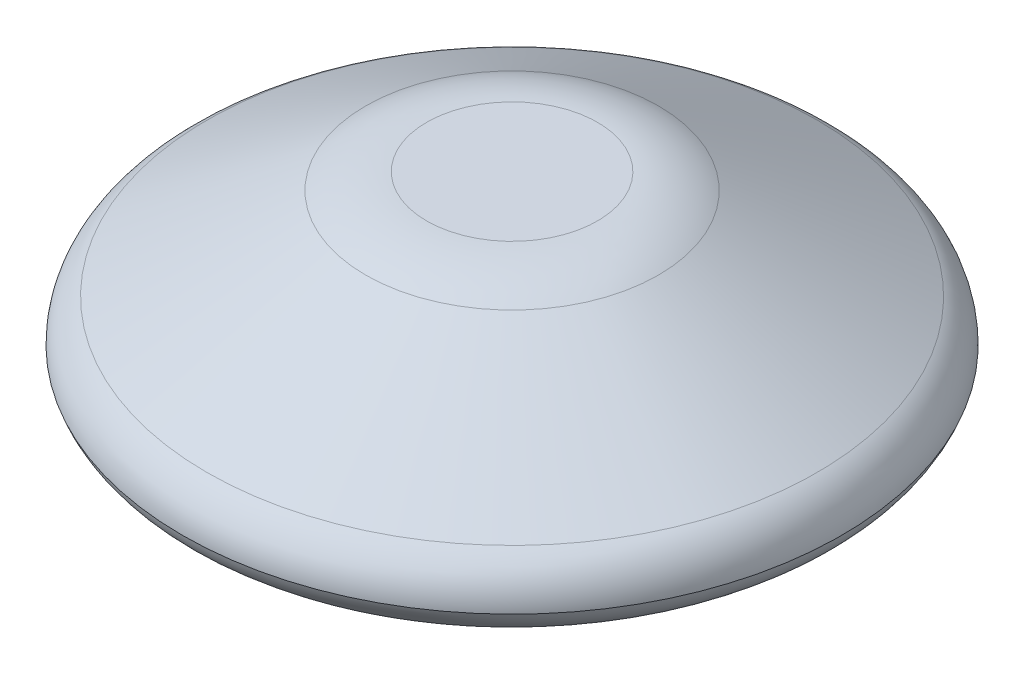
from build123d import *

# Parameters (mm, degrees)
IZIM1_R                     = 27
Y_KSEKLIK_EKSTR_ZYON1_DEPTH = 15
PAH1_SIZE                   = 10
PAH1_SIZE2                  = 17.320508076
RADYUS1_R                   = 10
RADYUS2_R                   = 4
RADYUS3_R                   = 4
IZIM2_R                     = 10
KES_EKSTR_ZYON1_DEPTH       = 2


with BuildPart() as part:
    # Çizim1 → Yükseklik-Ekstrüzyon1 (new body)
    with BuildSketch(Plane(origin=(0, 0, 0), x_dir=(1, 0, 0), z_dir=(0, 1, 0))):
        with Locations(Location((0, 0, 0), (0, 0, 270))):
            Circle(IZIM1_R)
    extrude(amount=Y_KSEKLIK_EKSTR_ZYON1_DEPTH)

    # Pah1
    pah1_edges = [part.edges().sort_by_distance(p)[0] for p in [
        (0, 15, -27),
    ]]
    pah1_side = [part.faces().sort_by_distance(p)[0] for p in [
        (0, 7.5, -27),
    ]]
    chamfer(pah1_edges, length=PAH1_SIZE, length2=PAH1_SIZE2, reference=pah1_side[0])

    # Radyus1
    radyus1_edges = [part.edges().sort_by_distance(p)[0] for p in [
        (0, 15, -9.679491924),
    ]]
    fillet(radyus1_edges, radius=RADYUS1_R)

    # Radyus2
    radyus2_edges = [part.edges().sort_by_distance(p)[0] for p in [
        (0, 5, -27),
    ]]
    fillet(radyus2_edges, radius=RADYUS2_R)

    # Radyus3
    # the kernel refuses this fillet: 4 mm, written as the material it takes off along each edge
    with BuildSketch(Plane(origin=(0, 0, 0), x_dir=(0, 0, 1), z_dir=(-1, 0, 0))) as radyus3_piece_1:
        with BuildLine():
            CenterArc((23.220386989, 4), RADYUS3_R, 270, 70.891973705)
            Line((23.220386989, 0), (23.220386989, -0.08))
            Line((23.220386989, -0.08), (27, -0.08))
            Line((27, -0.08), (27.08, 0))
            ThreePointArc((27.08, 0), (27.08, 1.345299462), (27.075591492, 2.664410902))
            Line((27.075591492, 2.664410902), (26.999999247, 2.690598923))
        make_face()
    revolve(axis=Axis((0, 0, 0), (0, 1, 0)), mode=Mode.SUBTRACT)

    # Çizim2 → Kes-Ekstrüzyon1 (cut)
    with BuildSketch(Plane.XZ):
        with Locations(Location((0, 0, 0), (0, 0, 270))):
            Circle(IZIM2_R)
    extrude(amount=-KES_EKSTR_ZYON1_DEPTH, mode=Mode.SUBTRACT)


solid = part.part
